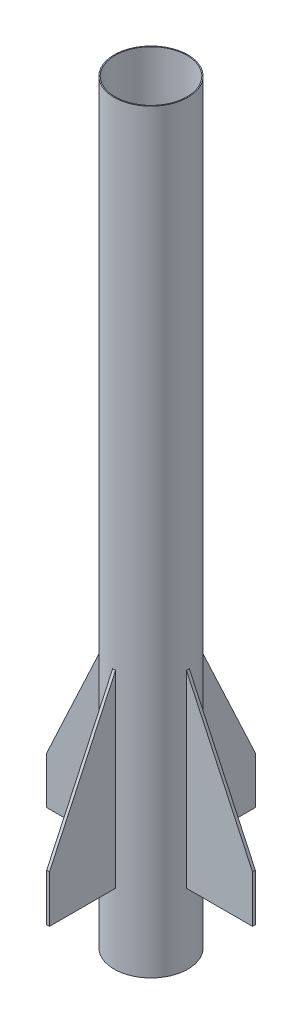
from build123d import *

# Parameters (mm, degrees)
SKETCH1_W                = 1.96
SKETCH1_H                = 1600
BOSS_EXTRUDE1_DEPTH      = 3
BOSS_EXTRUDE1_DEPTH_BACK = 3
CIRPATTERN2_COUNT        = 4


with BuildPart() as part:
    # Sketch1 → Revolve1 (revolve)
    with BuildSketch(Plane.XY):
        with Locations((77.18, 800)):
            Rectangle(SKETCH1_W, SKETCH1_H)
    revolve(axis=Axis((0, 0, 0), (0, 1, 0)))


with BuildPart() as body_2:
    # Sketch2 → Boss-Extrude1 (new, two sides: drawn at the far end of the back side and taken through both)
    with BuildSketch(Plane.XY.offset(-BOSS_EXTRUDE1_DEPTH_BACK)):
        Polygon((-78.16, 550), (-78.16, 150), (-218.16, 150), (-218.16, 250), align=None)
    extrude(amount=BOSS_EXTRUDE1_DEPTH + BOSS_EXTRUDE1_DEPTH_BACK)


with BuildPart() as cirpattern2_1:
    # CirPattern2: pattern copy
    add(body_2.part.rotate(Axis((0, 0, 0), (0, 1, 0)), 1 * 360 / CIRPATTERN2_COUNT))


with BuildPart() as cirpattern2_2:
    # CirPattern2: pattern copy
    add(body_2.part.rotate(Axis((0, 0, 0), (0, 1, 0)), 2 * 360 / CIRPATTERN2_COUNT))


with BuildPart() as cirpattern2_3:
    # CirPattern2: pattern copy
    add(body_2.part.rotate(Axis((0, 0, 0), (0, 1, 0)), 3 * 360 / CIRPATTERN2_COUNT))


solid = Compound([part.part, body_2.part, cirpattern2_1.part, cirpattern2_2.part, cirpattern2_3.part])
